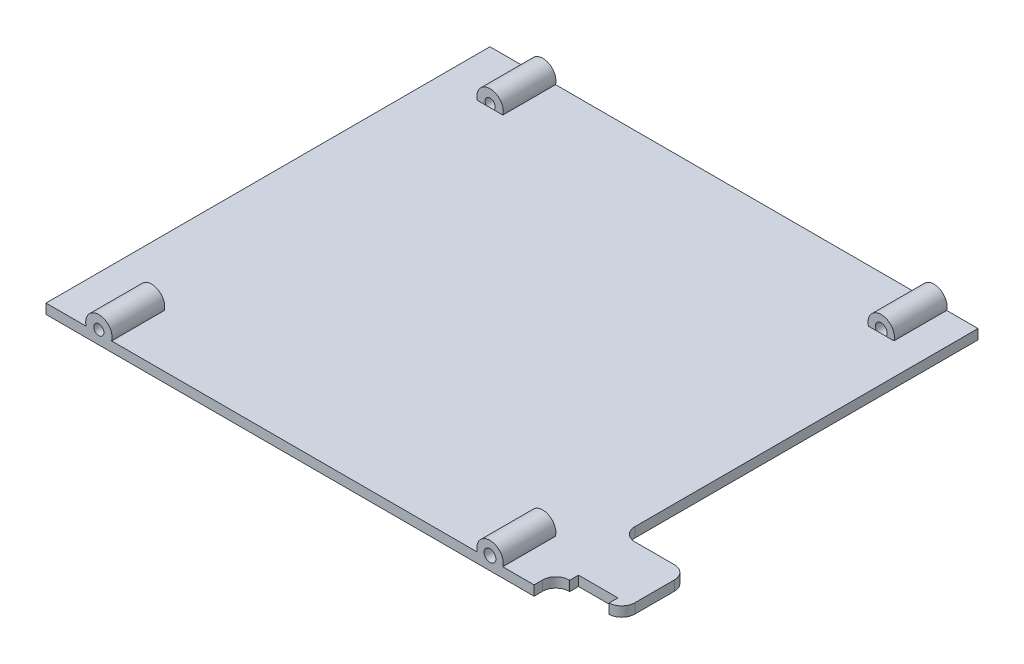
from build123d import *

# Parameters (mm, degrees)
SKETCH1_W             = 74.077377751
SKETCH1_H             = 1.5
BOSS_EXTRUDE1_DEPTH   = 67.38
SKETCH2_R             = 2
BOSS_EXTRUDE2_DEPTH   = 8
SKETCH3_R             = 0.769644957
SKETCH3_R_2           = 0.9
CUT_EXTRUDE1_DEPTH    = 8
BOSS_EXTRUDE3_START   = 8
SKETCH4_R             = 2
BOSS_EXTRUDE3_DEPTH   = 8
SKETCH5_R             = 0.9
SKETCH5_R_2           = 0.769644957
CUT_EXTRUDE2_DEPTH    = 8
BOSS_EXTRUDE4_START   = -20.367507575
BOSS_EXTRUDE4_DEPTH   = 1.5
BOSS_EXTRUDE4_START_2 = 64.08
BOSS_EXTRUDE4_2_DEPTH = 1.5
SKETCH7_W             = 5.986172604
SKETCH7_H             = 3.921086245
CUT_EXTRUDE4_DEPTH    = 174.349085042


with BuildPart() as part:
    # Sketch1 → Boss-Extrude1 (new body)
    with BuildSketch(Plane.XY):
        with Locations((-122.62921925, -19.617507575)):
            Rectangle(SKETCH1_W, SKETCH1_H)
    extrude(amount=BOSS_EXTRUDE1_DEPTH)

    # Sketch2 → Boss-Extrude2 (add)
    with BuildSketch(Plane.XY):
        with Locations((-151.644507933, -18.367507575)):
            Circle(SKETCH2_R)
        with Locations((-92.280362099, -18.367507575)):
            Circle(SKETCH2_R)
    extrude(amount=BOSS_EXTRUDE2_DEPTH)

    # Sketch3 → Cut-Extrude1 (cut)
    with BuildSketch(Plane(origin=(0, 0, 0), x_dir=(-1, 0, 0), z_dir=(0, 0, -1))):
        with Locations((151.644507933, -18.367507575)):
            Circle(SKETCH3_R)
        with Locations((92.280362099, -18.367507575)):
            Circle(SKETCH3_R_2)
    extrude(amount=-CUT_EXTRUDE1_DEPTH, mode=Mode.SUBTRACT)

    # Sketch4 → Boss-Extrude3 (add)
    with BuildSketch(Plane(origin=(0, 0, 67.38), x_dir=(-1, 0, 0), z_dir=(0, 0, -1)).offset(BOSS_EXTRUDE3_START)):
        with Locations((151.644507933, -18.367507575)):
            Circle(SKETCH4_R)
        with Locations((92.280362099, -18.367507575)):
            Circle(SKETCH4_R)
    extrude(amount=-BOSS_EXTRUDE3_DEPTH)

    # Sketch5 → Cut-Extrude2 (cut)
    with BuildSketch(Plane(origin=(0, 0, 59.38), x_dir=(-1, 0, 0), z_dir=(0, 0, -1))):
        with Locations((92.280362099, -18.367507575)):
            Circle(SKETCH5_R)
        with Locations((151.644507933, -18.367507575)):
            Circle(SKETCH5_R_2)
    extrude(amount=-CUT_EXTRUDE2_DEPTH, mode=Mode.SUBTRACT)

    # Boss-Extrude4: read off the stored shape, not the designer's step
    # Boss-Extrude4 outline → Boss-Extrude4 (add)
    with BuildSketch(Plane(origin=(0, 0, 0), x_dir=(1, 0, 0), z_dir=(0, 1, 0)).offset(BOSS_EXTRUDE4_START)):
        with BuildLine():
            ThreePointArc((-85.590530374, -66.08), (-85.004743937, -64.665786437), (-83.590530374, -64.08))
            Line((-83.590530374, -64.08), (-77.590530374, -64.08))
            ThreePointArc((-77.590530374, -64.08), (-76.176316812, -63.494213562), (-75.590530374, -62.08))
            Line((-75.590530374, -62.08), (-75.590530374, -56.08))
            ThreePointArc((-75.590530374, -56.08), (-76.176316812, -54.665786438), (-77.590530374, -54.08))
            Line((-77.590530374, -54.08), (-83.590530374, -54.08))
            ThreePointArc((-83.590530374, -54.08), (-85.004743937, -53.494213563), (-85.590530374, -52.08))
            Line((-85.590530374, -52.08), (-85.590530374, -66.08))
        make_face()
    extrude(amount=BOSS_EXTRUDE4_DEPTH)

    # Boss-Extrude4 2 outline → Boss-Extrude4 2 (add)
    with BuildSketch(Plane.XY.offset(BOSS_EXTRUDE4_START_2)):
        Polygon((-79.170711658, -18.867507575), (-82.010469997, -18.867507575), (-80.595461682, -19.68726796), align=None)
    extrude(amount=BOSS_EXTRUDE4_2_DEPTH)

    # Sketch7 → Cut-Extrude4 (cut, through all)
    with BuildSketch(Plane.XZ.offset(20.367507575)):
        with Locations((-80.502378911, 64.691696103)):
            Rectangle(SKETCH7_W, SKETCH7_H)
    extrude(amount=-CUT_EXTRUDE4_DEPTH, mode=Mode.SUBTRACT)


solid = part.part
